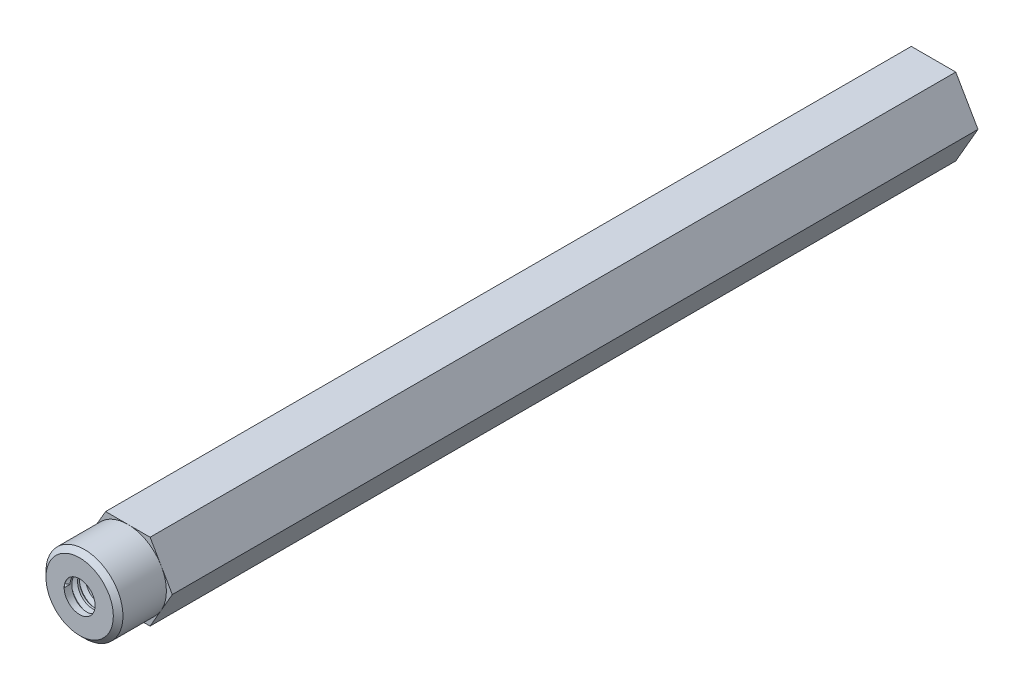
from build123d import *
from build123d.topology import SkipClean

# Parameters (mm, degrees)
EXTRUSI_N_HEX_PROFILE_DEPTH = 70.3961
TAP_START                   = 70.3961
CROQUIS3_R                  = 2.5527
TAP_HOLE_1_DEPTH            = 19.05
TAP_START_2                 = -51.3461
CROQUIS3_3_R                = 2.5527
TAP_HOLE_2_DEPTH            = 19.05
ROSCA1_PITCH                = 1.27
ROSCA2_PITCH                = 1.27


with BuildPart() as part:
    # Croquis2 → Extrusión Hex Profile (new, symmetric)
    with BuildSketch(Plane.XY):
        Polygon((3.666174209, -6.35), (7.332348419, 0), (3.666174209, 6.35), (-3.666174209, 6.35), (-7.332348419, 0), (-3.666174209, -6.35), align=None)
    extrude(amount=EXTRUSI_N_HEX_PROFILE_DEPTH, both=True)

    # Croquis3 → Tap Hole 1 (cut)
    with BuildSketch(Plane.XY.offset(TAP_START)):
        Circle(CROQUIS3_R)
    extrude(amount=-TAP_HOLE_1_DEPTH, mode=Mode.SUBTRACT)

    # Croquis3<3> → Tap Hole 2 (cut)
    with BuildSketch(Plane.XY.offset(TAP_START_2)):
        Circle(CROQUIS3_3_R)
    extrude(amount=-TAP_HOLE_2_DEPTH, mode=Mode.SUBTRACT)

    # Croquis10 → Round End 1 (revolve, cut)
    with BuildSketch(Plane(origin=(0, 0, 0), x_dir=(1, 0, 0), z_dir=(0, 1, 0)), mode=Mode.PRIVATE) as round_end_1_sk:
        Polygon((-5.55625, -70.3961), (-6.35, -69.60235), (-6.35, -62.4459), (-9.525, -62.4459), (-9.525, -70.3961), align=None)
    revolve(round_end_1_sk.sketch.rotate(Axis((0, 0, 70.3961), (0, 0, -1)), 180), axis=Axis((0, 0, 70.3961), (0, 0, -1)), mode=Mode.SUBTRACT)

    # Rosca1: the profile of Perfil de rosca1 profile screwed along a right-hand helix of 15 turns, 8 arcs to a turn; built about Z, then put on its axis
    rosca1_z = Axis((0, 0, 0), (0, 0, 1))
    rosca1_corners = [(2.5524, 0, -0.000173205), (3.240107661, 0, 0.396874998), (3.240107661, 0, 0.555624998), (2.5524, 0, 0.952673202)]
    with BuildLine(mode=Mode.PRIVATE) as rosca1_profile:
        Line(rosca1_corners[0], rosca1_corners[1])
        Line(rosca1_corners[1], rosca1_corners[2])
        Line(rosca1_corners[2], rosca1_corners[3])
        Line(rosca1_corners[3], rosca1_corners[0])
    rosca1_cap = Face(rosca1_profile.wire())
    rosca1_turn_angles = [0, 22.5, 45, 67.5, 90, 112.5, 135, 157.5, 180, 202.5, 225, 247.5, 270, 292.5, 315, 337.5, 360]
    rosca1_turn_weights = [1, 0.9238795325112867, 1, 0.9238795325112867, 1, 0.9238795325112867, 1, 0.9238795325112867, 1, 0.9238795325112867, 1, 0.9238795325112867, 1, 0.9238795325112867, 1, 0.9238795325112867, 1]
    rosca1_turn_rails = [Edge.make_bspline([Vector(p[0], p[1], 0).rotate(rosca1_z, rosca1_turn_angles[k]) / rosca1_turn_weights[k] + Vector(0, 0, p[2] + ROSCA1_PITCH * rosca1_turn_angles[k] / 360) for k in range(17)], [0, 0, 0, 1, 1, 2, 2, 3, 3, 4, 4, 5, 5, 6, 6, 7, 7, 8, 8, 8], 2, rosca1_turn_weights) for p in rosca1_corners]
    rosca1_turn_sides = [Face.make_surface_from_curves(rosca1_turn_rails[p[0]], rosca1_turn_rails[p[1]]) for p in [(0, 1), (1, 2), (2, 3), (3, 0)]]
    rosca1 = Plane(origin=(0, 0, -70.3961), x_dir=(1, 0, 0), z_dir=(0, 0, 1)) * Solid(Shell([*[p.moved(Location((0, 0, ROSCA1_PITCH * i))) for i in range(15) for p in rosca1_turn_sides], rosca1_cap, rosca1_cap.rotate(rosca1_z, 5400).moved(Location((0, 0, ROSCA1_PITCH * 5400 / 360)))]))
    add(rosca1, mode=Mode.SUBTRACT)

    # Rosca2: the profile of Perfil de rosca2 profile screwed along a right-hand helix of 15 turns, 8 arcs to a turn; built about Z, then put on its axis
    with SkipClean():  # the faces are left unmerged after this step: merging them gives an invalid solid
        rosca2_z = Axis((0, 0, 0), (0, 0, 1))
        rosca2_corners = [(2.5524, 0, -0.000173205), (3.240107661, 0, 0.396874998), (3.240107661, 0, 0.555624998), (2.5524, 0, 0.952673202)]
        with BuildLine(mode=Mode.PRIVATE) as rosca2_profile:
            Line(rosca2_corners[0], rosca2_corners[1])
            Line(rosca2_corners[1], rosca2_corners[2])
            Line(rosca2_corners[2], rosca2_corners[3])
            Line(rosca2_corners[3], rosca2_corners[0])
        rosca2_cap = Face(rosca2_profile.wire())
        rosca2_turn_angles = [0, 22.5, 45, 67.5, 90, 112.5, 135, 157.5, 180, 202.5, 225, 247.5, 270, 292.5, 315, 337.5, 360]
        rosca2_turn_weights = [1, 0.9238795325112867, 1, 0.9238795325112867, 1, 0.9238795325112867, 1, 0.9238795325112867, 1, 0.9238795325112867, 1, 0.9238795325112867, 1, 0.9238795325112867, 1, 0.9238795325112867, 1]
        rosca2_turn_rails = [Edge.make_bspline([Vector(p[0], p[1], 0).rotate(rosca2_z, rosca2_turn_angles[k]) / rosca2_turn_weights[k] + Vector(0, 0, p[2] + ROSCA2_PITCH * rosca2_turn_angles[k] / 360) for k in range(17)], [0, 0, 0, 1, 1, 2, 2, 3, 3, 4, 4, 5, 5, 6, 6, 7, 7, 8, 8, 8], 2, rosca2_turn_weights) for p in rosca2_corners]
        rosca2_turn_sides = [Face.make_surface_from_curves(rosca2_turn_rails[p[0]], rosca2_turn_rails[p[1]]) for p in [(0, 1), (1, 2), (2, 3), (3, 0)]]
        rosca2 = Plane(origin=(0, 0, 70.3961), x_dir=(-1, 0, 0), z_dir=(0, 0, -1)) * Solid(Shell([*[p.moved(Location((0, 0, ROSCA2_PITCH * i))) for i in range(15) for p in rosca2_turn_sides], rosca2_cap, rosca2_cap.rotate(rosca2_z, 5400).moved(Location((0, 0, ROSCA2_PITCH * 5400 / 360)))]))
        add(rosca2, mode=Mode.SUBTRACT)


solid = part.part
